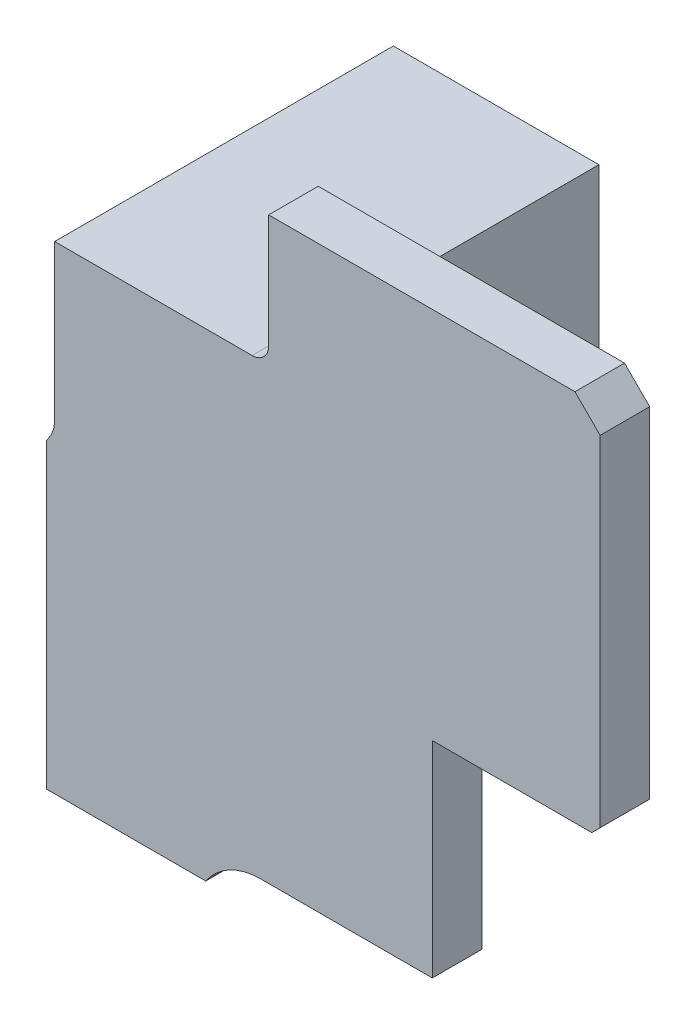
from build123d import *

# Parameters (mm, degrees)
EXTRUDE_1_DEPTH = 1.5
SKETCH_2_W      = 4.318
SKETCH_2_H      = 5.334
EXTRUDE_2_DEPTH = 1.5
SKETCH_3_W      = 6.223
SKETCH_3_H      = 5.08
EXTRUDE_3_DEPTH = 8.75
FILLET_1_R      = 1
FILLET_2_R      = 2


with BuildPart() as part:
    # 草图1 → 凸台-拉伸1 (new body)
    with BuildSketch(Plane.XY):
        with BuildLine():
            Line((90.932, 85.09), (91.186, 85.344))
            Line((91.186, 85.344), (91.186, 90.424))
            Line((91.186, 90.424), (97.162789, 90.424))
            ThreePointArc((97.162789, 90.424), (97.51649159, 90.57050841), (97.663, 90.924211))
            Line((97.663, 90.924211), (97.663, 94.361))
            Line((97.663, 94.361), (106.934, 94.361))
            Line((106.934, 94.361), (107.696, 93.599))
            Line((107.696, 93.599), (107.696, 83.312))
            Line((107.696, 83.312), (107.442, 83.058))
            Line((107.442, 83.058), (102.616, 83.058))
            Line((102.616, 83.058), (102.616, 76.833545254))
            Line((102.616, 76.833545254), (95.758, 76.833545254))
            Line((95.758, 76.833545254), (95.758, 75.946))
            Line((95.758, 75.946), (90.932, 75.946))
            Line((90.932, 75.946), (90.932, 85.09))
        make_face()
    extrude(amount=EXTRUDE_1_DEPTH)

    # 草图2 → 凸台-拉伸2 (add)
    with BuildSketch(Plane.XY):
        with Locations((93.091, 78.613)):
            Rectangle(SKETCH_2_W, SKETCH_2_H)
    extrude(amount=-EXTRUDE_2_DEPTH)

    # 草图3 → 凸台-拉伸3 (add)
    with BuildSketch(Plane.XY):
        with Locations((94.2975, 87.884)):
            Rectangle(SKETCH_3_W, SKETCH_3_H)
    extrude(amount=-EXTRUDE_3_DEPTH)

    # 圆角1
    # the kernel refuses this fillet: 1 mm, written as the material it adds along each edge
    with BuildSketch(Plane(origin=(91.186, 85.344, 0), x_dir=(-0.7071067811889411, -0.7071067811841542, 0), z_dir=(0, 0, 1))) as fillet_1_piece_1:
        with BuildLine():
            CenterArc((0.415817011, -0.998396551), FILLET_1_R, 93.245063402, 41.754936598)
            Line((-0.29128977, -0.29128977), (0, 0))
            Line((0, 0), (0.359210245, 0))
        make_face()
    extrude(amount=1.5)

    # 圆角2
    # the kernel refuses this fillet: 2 mm, written as the material it adds along each edge
    with BuildSketch(Plane(origin=(95.758, 76.833545254, 0), x_dir=(1, 0, 0), z_dir=(0, 0, 1))) as fillet_2_piece_1:
        with BuildLine():
            CenterArc((1.662060299, -2), FILLET_2_R, 90, 56.204705158)
            Line((0, -0.887545254), (-0.033241206, -0.86529616))
            ThreePointArc((-0.033241206, -0.86529616), (-0.04, -0.443772627), (-0.04, 0))
            Line((-0.04, 0), (0, 0.04))
            Line((0, 0.04), (1.662060299, 0.04))
            Line((1.662060299, 0.04), (1.662060299, 0))
        make_face()
    extrude(amount=1.5)


solid = part.part
